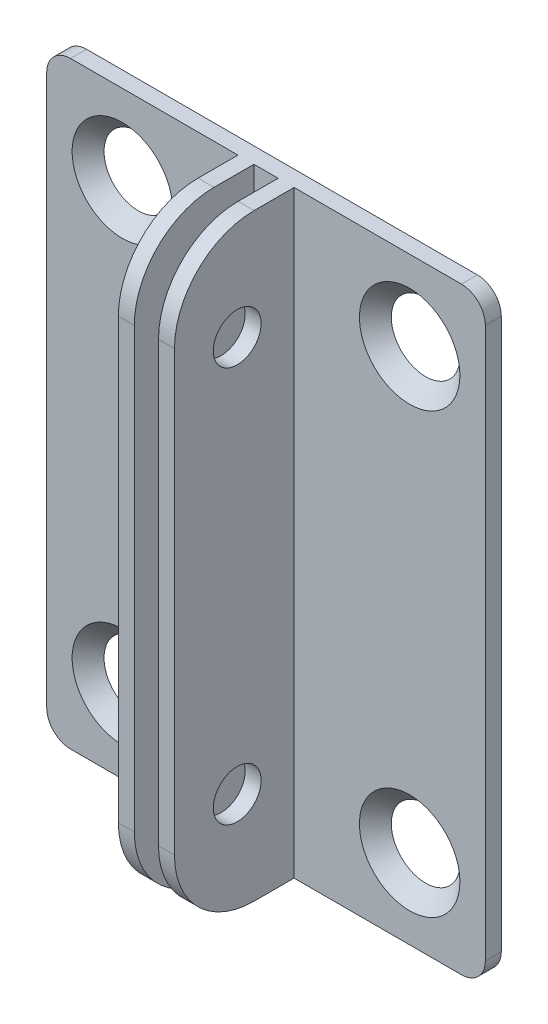
from build123d import *

# Parameters (mm, degrees)
ESQUISSE1_W                  = 55
ESQUISSE1_H                  = 75
BOSS_EXTRU_1_DEPTH           = 2
ESQUISSE2_W                  = 2.002378602
ESQUISSE2_H                  = 75
BOSS_EXTRU_2_DEPTH           = 15
CONG_1_R                     = 3
CONG_2_R                     = 10
ENL_V_MAT_EXTRU_1_DEPTH      = 10
ENL_V_MAT_EXTRU_1_DEPTH_BACK = 83.194496151
ESQUISSE6_R                  = 3


# Read off the part's stored shape, not the designer's step: Fraisage pour vis à tête fraisée M61
with BuildPart() as part:
    # Esquisse1 → Boss.-Extru.1 (new body)
    with BuildSketch(Plane.XY):
        with Locations((27.5, 37.5)):
            Rectangle(ESQUISSE1_W, ESQUISSE1_H)
    extrude(amount=BOSS_EXTRU_1_DEPTH)

    # Esquisse2 → Boss.-Extru.2 (add)
    with BuildSketch(Plane.XY.offset(2)):
        with Locations((30.017308917, 37.5)):
            Rectangle(ESQUISSE2_W, ESQUISSE2_H)
        with Locations((24.982691083, 37.5)):
            Rectangle(ESQUISSE2_W, ESQUISSE2_H)
    extrude(amount=BOSS_EXTRU_2_DEPTH)

    # Congé1
    cong_1_edges = [part.edges().sort_by_distance(p)[0] for p in [
        (0, 75, 1),
        (55, 75, 1),
        (55, 0, 1),
        (0, 0, 1),
    ]]
    fillet(cong_1_edges, radius=CONG_1_R)

    # Congé2
    cong_2_edges = [part.edges().sort_by_distance(p)[0] for p in [
        (24.982691083, 75, 17),
        (24.982691083, 0, 17),
        (30.017308917, 0, 17),
        (30.017308917, 75, 17),
    ]]
    fillet(cong_2_edges, radius=CONG_2_R)

    # Fraisage pour vis à tête fraisée M61 out → Fraisage pour vis à tête fraisée M61 (revolve, cut)
    with BuildSketch(Plane(origin=(45.511606252, 65, 0), x_dir=(1, 0, 0), z_dir=(0, -1, 0))):
        Polygon((6.3, 2), (0, 2), (0, 0), (4.3, 0), align=None)
    revolve(axis=Axis((45.511606252, 65, 0), (0, 0, 1)), mode=Mode.SUBTRACT)

    # Fraisage pour vis _ t_te frais_e M61 2 o → Fraisage pour vis _ t_te frais_e M61 2 (revolve, cut)
    with BuildSketch(Plane(origin=(45.511606252, 10, 0), x_dir=(1, 0, 0), z_dir=(0, -1, 0))):
        Polygon((6.3, 2), (0, 2), (0, 0), (4.3, 0), align=None)
    revolve(axis=Axis((45.511606252, 10, 0), (0, 0, 1)), mode=Mode.SUBTRACT)

    # Fraisage pour vis _ t_te frais_e M61 3 o → Fraisage pour vis _ t_te frais_e M61 3 (revolve, cut)
    with BuildSketch(Plane(origin=(9.488393748, 10, 0), x_dir=(1, 0, 0), z_dir=(0, -1, 0))):
        Polygon((6.3, 2), (0, 2), (0, 0), (4.3, 0), align=None)
    revolve(axis=Axis((9.488393748, 10, 0), (0, 0, 1)), mode=Mode.SUBTRACT)

    # Fraisage pour vis _ t_te frais_e M61 4 o → Fraisage pour vis _ t_te frais_e M61 4 (revolve, cut)
    with BuildSketch(Plane(origin=(9.488393748, 65, 0), x_dir=(1, 0, 0), z_dir=(0, -1, 0))):
        Polygon((6.3, 2), (0, 2), (0, 0), (4.3, 0), align=None)
    revolve(axis=Axis((9.488393748, 65, 0), (0, 0, 1)), mode=Mode.SUBTRACT)

    # Esquisse6 → Enlèv. mat.-Extru.1 (cut, two sides: drawn at the far end of the back side and taken through both)
    with BuildSketch(Plane(origin=(25.983880384, 0, 0), x_dir=(0, 0, -1), z_dir=(1, 0, 0)).offset(-ENL_V_MAT_EXTRU_1_DEPTH_BACK)):
        with Locations(Location((-9.133710771, 62.312214024, 0), (0, 0, 270))):
            Circle(ESQUISSE6_R)
        with Locations(Location((-9.133710771, 12.687785976, 0), (0, 0, 270))):
            Circle(ESQUISSE6_R)
    extrude(amount=ENL_V_MAT_EXTRU_1_DEPTH + ENL_V_MAT_EXTRU_1_DEPTH_BACK, mode=Mode.SUBTRACT)


solid = part.part
